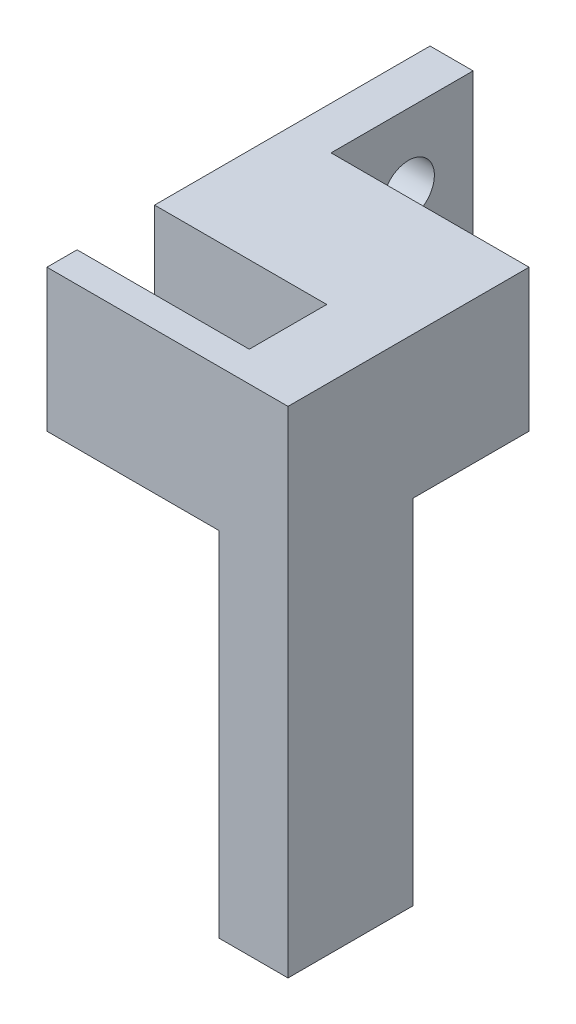
from build123d import *

# Parameters (mm, degrees)
SKETCH_1_W          = 2.9
SKETCH_1_H          = 11.5
EXTRUDE_1_DEPTH     = 1.6
SKETCH_2_W          = 0.7
SKETCH_2_H          = 3.3
SKETCH_2_W_2        = 0.4
EXTRUDE_2_DEPTH     = 4
SKETCH_3_W          = 5.6
SKETCH_3_H          = 3.3
EXTRUDE_3_DEPTH     = 3
SKETCH_4_W          = 1
SKETCH_4_H          = 3.3
EXTRUDE_4_DEPTH     = 3
SKETCH_5_R          = 0.6
CUT_EXTRUDE_1_DEPTH = 14.762630563
SKETCH_6_W          = 4.6
SKETCH_6_H          = 3.3
CUT_EXTRUDE_2_DEPTH = 0.3


with BuildPart() as part:
    # 草图1 → 凸台-拉伸1 (new body)
    with BuildSketch(Plane(origin=(0, 0, 0), x_dir=(0, 0, -1), z_dir=(1, 0, 0))):
        with Locations((-1.45, -5.75)):
            Rectangle(SKETCH_1_W, SKETCH_1_H)
    extrude(amount=EXTRUDE_1_DEPTH)

    # 草图2 → 凸台-拉伸2 (add)
    with BuildSketch(Plane.ZY):
        with Locations((2.55, -1.65)):
            Rectangle(SKETCH_2_W, SKETCH_2_H)
        with Locations((0.2, -1.65)):
            Rectangle(SKETCH_2_W_2, SKETCH_2_H)
    extrude(amount=EXTRUDE_2_DEPTH)

    # 草图3 → 凸台-拉伸3 (add)
    with BuildSketch(Plane(origin=(0, 0, 0), x_dir=(-1, 0, 0), z_dir=(0, 0, -1))):
        with Locations((1.2, -1.65)):
            Rectangle(SKETCH_3_W, SKETCH_3_H)
    extrude(amount=EXTRUDE_3_DEPTH)

    # 草图4 → 凸台-拉伸4 (add)
    with BuildSketch(Plane(origin=(0, 0, -3), x_dir=(-1, 0, 0), z_dir=(0, 0, -1))):
        with Locations((3.5, -1.65)):
            Rectangle(SKETCH_4_W, SKETCH_4_H)
    extrude(amount=EXTRUDE_4_DEPTH)

    # 草图5 → 切除-拉伸1 (cut, through all)
    with BuildSketch(Plane(origin=(-3, 0, 0), x_dir=(0, 0, -1), z_dir=(1, 0, 0))):
        with Locations((4.5, -1.65)):
            Circle(SKETCH_5_R)
    extrude(amount=-CUT_EXTRUDE_1_DEPTH, mode=Mode.SUBTRACT)

    # 草图6 → 切除-拉伸2 (cut)
    with BuildSketch(Plane(origin=(0, 0, -3), x_dir=(-1, 0, 0), z_dir=(0, 0, -1))):
        with Locations((0.7, -1.65)):
            Rectangle(SKETCH_6_W, SKETCH_6_H)
    extrude(amount=-CUT_EXTRUDE_2_DEPTH, mode=Mode.SUBTRACT)


solid = part.part
